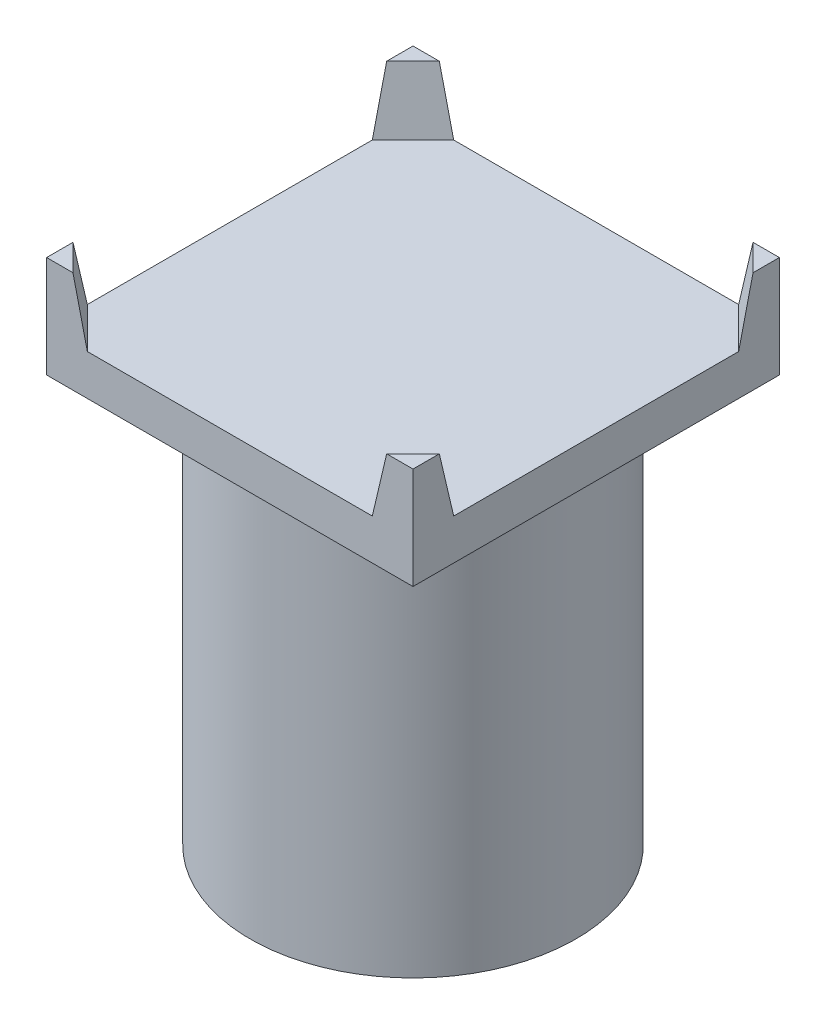
from build123d import *

# Parameters (mm, degrees)
SKETCH1_W           = 18
SKETCH1_H           = 18
BOSS_EXTRUDE1_DEPTH = 2
BOSS_EXTRUDE2_DEPTH = 3
CUT_EXTRUDE4_DEPTH  = 3
SKETCH5_R           = 8
BOSS_EXTRUDE3_DEPTH = 20
SKETCH6_R           = 2.5
CUT_EXTRUDE5_DEPTH  = 20
SKETCH7_R           = 1.5
CUT_EXTRUDE6_DEPTH  = 20


# Read off the part's stored shape, not the designer's step: Mirror1, Mirror2
with BuildPart() as part:
    # Sketch1 → Boss-Extrude1 (new body)
    with BuildSketch(Plane(origin=(0, 0, 0), x_dir=(1, 0, 0), z_dir=(0, 1, 0))):
        Rectangle(SKETCH1_W, SKETCH1_H)
    extrude(amount=BOSS_EXTRUDE1_DEPTH)

    # Sketch2 → Boss-Extrude2 (add)
    with BuildSketch(Plane(origin=(0, 2, 0), x_dir=(1, 0, 0), z_dir=(0, 1, 0))):
        Polygon((-9, 9), (-7, 9), (-9, 7), align=None)
        Polygon((9, 7), (9, 9), (7, 9), align=None)
        Polygon((7, -9), (9, -7), (9, -9), align=None)
        Polygon((-9, -7), (-9, -9), (-7, -9), align=None)
    extrude(amount=BOSS_EXTRUDE2_DEPTH)

    # Sketch4 → Cut-Extrude4 (cut)
    with BuildSketch(Plane(origin=(-7.554451855, -1.780601378, -7.554451855), x_dir=(0.7165985720844784, -0.16001422411879979, -0.678882857764243), z_dir=(0.697485832462916, 0.16439898730535757, 0.6974858324629155))):
        Polygon((-2.017235593, 6.634774192), (-2.017235593, 3.552567191), (0.773727267, 4.011398658), (-0.213027115, 6.931384239), align=None)
    extrude(amount=CUT_EXTRUDE4_DEPTH, mode=Mode.SUBTRACT)


with BuildPart() as cut_extrude4_kept_piece:
    # of the separate pieces the step leaves, the one the design keeps (cut_extrude4_pieces_kept)
    add(part.part.solids().sort_by_distance((-9, 0, -9))[0])

    # Mirror1
    split(bisect_by=Plane(origin=(0, 0, 0), x_dir=(0, 0, 1), z_dir=(1, 0, 0)), keep=Keep.BOTTOM)

    # Mirror1 2: Cut-Extrude4 kept piece across plane


with BuildPart() as cut_extrude4_kept_piece_1:
    add(cut_extrude4_kept_piece.part)
    add(cut_extrude4_kept_piece.part.mirror(Plane(origin=(0, 0, 0), x_dir=(0, 0, 1), z_dir=(1, 0, 0))))

    # Mirror2
    split(bisect_by=Plane.XY, keep=Keep.BOTTOM)

    # Mirror2 2: Cut-Extrude4 kept piece across plane


with BuildPart() as cut_extrude4_kept_piece_2:
    add(cut_extrude4_kept_piece_1.part)
    add(cut_extrude4_kept_piece_1.part.mirror(Plane.XY))

    # Sketch5 → Boss-Extrude3 (add)
    with BuildSketch(Plane.XZ):
        with Locations(Location((0, 0, 0), (0, 0, 270))):
            Circle(SKETCH5_R)
    extrude(amount=BOSS_EXTRUDE3_DEPTH)

    # Sketch6 → Cut-Extrude5 (cut)
    with BuildSketch(Plane.XZ.offset(20)):
        with Locations(Location((0, 0, 0), (0, 0, 270))):
            Circle(SKETCH6_R)
    extrude(amount=-CUT_EXTRUDE5_DEPTH, mode=Mode.SUBTRACT)

    # Sketch7 → Cut-Extrude6 (cut)
    with BuildSketch(Plane.XY):
        with Locations(Location((0, -10, 0), (0, 0, 90))):
            Circle(SKETCH7_R)
    extrude(amount=-CUT_EXTRUDE6_DEPTH, mode=Mode.SUBTRACT)


solid = cut_extrude4_kept_piece_2.part
